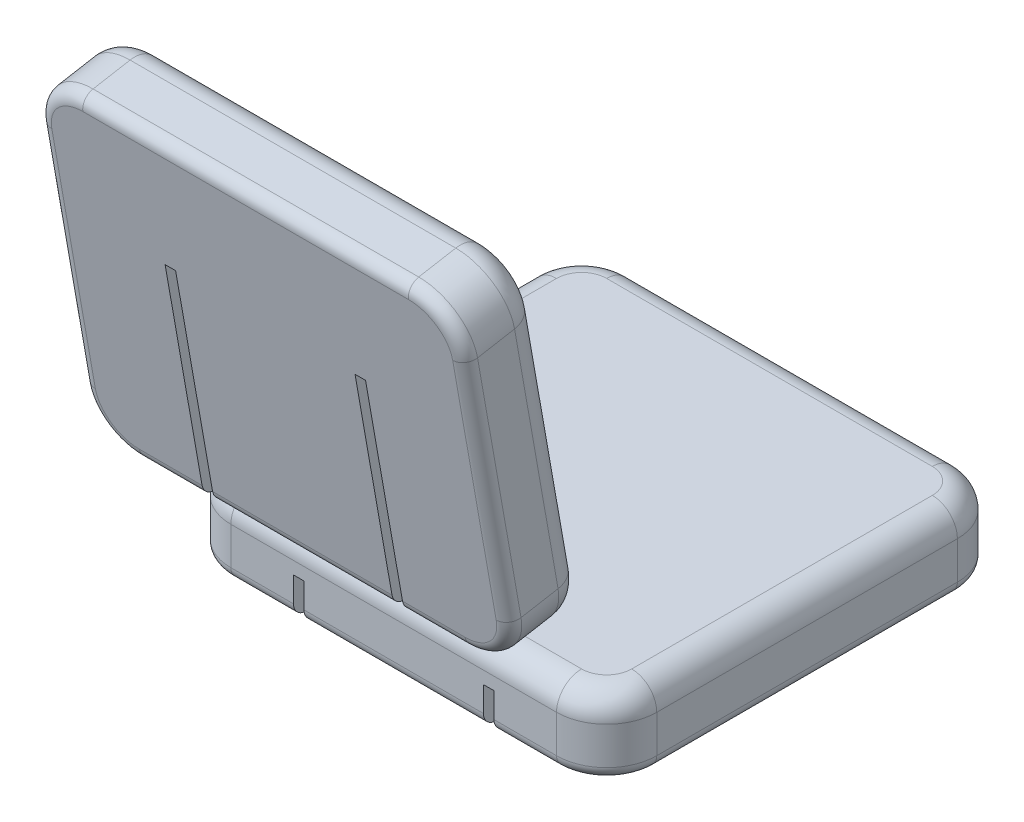
from build123d import *

# Parameters (mm, degrees)
SKETCH1_W           = 160
SKETCH1_H           = 30
BOSS_EXTRUDE1_DEPTH = 85
FILLET5_R           = 5
FILLET6_R           = 5
CUT_EXTRUDE1_START  = -40
CUT_EXTRUDE1_DEPTH  = 4.2
FILLET1_R           = 20
FILLET2_R           = 20
FILLET3_R           = 10
FILLET4_R           = 10
CUT_EXTRUDE3_DEPTH  = 13
FILLET7_R           = 2


with BuildPart() as part:
    # Sketch1 → Boss-Extrude1 (new, symmetric)
    with BuildSketch(Plane(origin=(0, 0, 0), x_dir=(0, 0, -1), z_dir=(1, 0, 0))):
        with Locations((0, -167.4)):
            Rectangle(SKETCH1_W, SKETCH1_H)
        Polygon((-136.5722642, -4.325861041), (-131.250254799, -34.508476203), (-116.478138504, -31.903753538), (-100.849802514, -120.53645131), (-86.077686218, -117.931728645), (-110.388431092, 19.941356777), (-139.932663682, 14.731911447), align=None)
        Polygon((-131.250254799, -34.508476203), (-115.621918809, -123.141173975), (-100.849802514, -120.53645131), (-116.478138504, -31.903753538), align=None)
    extrude(amount=BOSS_EXTRUDE1_DEPTH, both=True)

    # Fillet5
    fillet5_edges = [part.edges().sort_by_distance(p)[0] for p in [
        (0, -123.141173975, 115.621918809),
        (85, -54.204631264, 127.777291245),
        (-85, -54.204631264, 127.777291245),
        (0, 14.731911447, 139.932663682),
    ]]
    fillet(fillet5_edges, radius=FILLET5_R)

    # Fillet6
    fillet6_edges = [part.edges().sort_by_distance(p)[0] for p in [
        (85, -182.4, 0),
        (-85, -182.4, 0),
        (0, -182.4, 80),
        (0, -182.4, -80),
    ]]
    fillet(fillet6_edges, radius=FILLET6_R)

    # Sketch2 → Cut-Extrude1 (cut)
    with BuildSketch(Plane(origin=(0, 0, 0), x_dir=(0, 0, -1), z_dir=(1, 0, 0)).offset(CUT_EXTRUDE1_START)):
        with BuildLine():
            Line((-131.250254799, -34.508476203), (-108.815691981, -161.741204442))
            ThreePointArc((-108.815691981, -161.741204442), (-100.265188398, -176.551111078), (-84.195498156, -182.4))
            Line((-84.195498156, -182.4), (-80, -182.4))
            Line((-80, -182.4), (20, -182.4))
            Line((20, -182.4), (20, -167.4))
            Line((20, -167.4), (-80, -167.4))
            Line((-80, -167.4), (-84.195498156, -167.4))
            ThreePointArc((-84.195498156, -167.4), (-90.623374253, -165.060444431), (-94.043575686, -159.136481777))
            Line((-94.043575686, -159.136481777), (-116.478138504, -31.903753538))
            Line((-116.478138504, -31.903753538), (-131.250254799, -34.508476203))
        make_face()
    cut_extrude1 = extrude(amount=CUT_EXTRUDE1_DEPTH, mode=Mode.SUBTRACT)

    # Mirror1: Cut-Extrude1 across plane
    add(cut_extrude1.mirror(Plane(origin=(0, 0, 0), x_dir=(0, 0, 1), z_dir=(1, 0, 0))), mode=Mode.SUBTRACT)

    # Fillet1
    # the kernel refuses this fillet: 20 mm, written as the material it takes off along each edge
    with BuildSketch(Plane(origin=(65, -182.4, -60), x_dir=(0, 0, -1), z_dir=(-1, 0, 0))) as fillet1_piece_1:
        with BuildLine():
            CenterArc((15, -5), 5, 0, 90)
            Line((20, -5), (20, 0))
            Line((20, 0), (15, 0))
        make_face()
    revolve(axis=Axis((65, -182.4, -60), (0, -1, 0)), revolution_arc=90, mode=Mode.SUBTRACT)
    with BuildSketch(Plane(origin=(-65, -182.4, -60), x_dir=(-1, 0, 0), z_dir=(0, 0, 1))) as fillet1_piece_2:
        with BuildLine():
            CenterArc((15, -5), 5, 0, 90)
            Line((20, -5), (20, 0))
            Line((20, 0), (15, 0))
        make_face()
    revolve(axis=Axis((-65, -182.4, -60), (0, -1, 0)), revolution_arc=90, mode=Mode.SUBTRACT)
    with BuildSketch(Plane(origin=(65, -182.4, 60), x_dir=(1, 0, 0), z_dir=(0, 0, -1))) as fillet1_piece_3:
        with BuildLine():
            CenterArc((15, -5), 5, 0, 90)
            Line((20, -5), (20, 0))
            Line((20, 0), (15, 0))
        make_face()
    revolve(axis=Axis((65, -182.4, 60), (0, -1, 0)), revolution_arc=90, mode=Mode.SUBTRACT)
    with BuildSketch(Plane(origin=(-65, -182.4, 60), x_dir=(0, 0, 1), z_dir=(1, 0, 0))) as fillet1_piece_4:
        with BuildLine():
            CenterArc((15, -5), 5, 0, 90)
            Line((20, -5), (20, 0))
            Line((20, 0), (15, 0))
        make_face()
    revolve(axis=Axis((-65, -182.4, 60), (0, -1, 0)), revolution_arc=90, mode=Mode.SUBTRACT)
    with BuildSketch(Plane(origin=(85, -102.4, -80), x_dir=(0, 0, 1), z_dir=(0, -1, 0)), Plane(origin=(85, -182.4, 80), x_dir=(0, 0, -1), z_dir=(0, 1, 0)), Plane(origin=(-85, -182.4, 80), x_dir=(1, 0, 0), z_dir=(0, 1, 0))) as fillet1_piece_5:
        with BuildLine():
            CenterArc((FILLET1_R, FILLET1_R), FILLET1_R, 180, 90)
            Line((0, FILLET1_R), (0, 0))
            Line((0, 0), (FILLET1_R, 0))
        make_face()
    extrude(amount=80, mode=Mode.SUBTRACT)
    with BuildSketch(Plane(origin=(-85, -102.4, -80), x_dir=(0, 0, 1), z_dir=(0, -1, 0))) as fillet1_piece_6:
        with BuildLine():
            CenterArc((FILLET1_R, -FILLET1_R), FILLET1_R, 90, 90)
            Line((0, -FILLET1_R), (0, 0))
            Line((0, 0), (FILLET1_R, 0))
        make_face()
    extrude(amount=80, mode=Mode.SUBTRACT)

    # Fillet2
    # the kernel refuses this fillet: 20 mm, written as the material it takes off along each edge
    with BuildSketch(Plane(origin=(65, -103.445018914, 119.094882362), x_dir=(0, -0.9848077530122086, -0.17364817766692728), z_dir=(-1, 0, 0))) as fillet2_piece_1:
        with BuildLine():
            CenterArc((15, -5), 5, 0, 90)
            Line((20, -5), (20, 0))
            Line((20, 0), (15, 0))
        make_face()
    revolve(axis=Axis((65, -103.445018914, 119.094882362), (0, -0.17364817766692778, 0.9848077530122086)), revolution_arc=90, mode=Mode.SUBTRACT)
    with BuildSketch(Plane(origin=(-65, -103.445018914, 119.094882362), x_dir=(-1, 0, 0), z_dir=(0, 0.9848077530122086, 0.17364817766692778))) as fillet2_piece_2:
        with BuildLine():
            CenterArc((15, -5), 5, 0, 90)
            Line((20, -5), (20, 0))
            Line((20, 0), (15, 0))
        make_face()
    revolve(axis=Axis((-65, -103.445018914, 119.094882362), (0, -0.17364817766692778, 0.9848077530122086)), revolution_arc=90, mode=Mode.SUBTRACT)
    with BuildSketch(Plane(origin=(65, -4.964243613, 136.459700129), x_dir=(1, 0, 0), z_dir=(0, -0.9848077530122086, -0.17364817766692778))) as fillet2_piece_3:
        with BuildLine():
            CenterArc((15, -5), 5, 0, 90)
            Line((20, -5), (20, 0))
            Line((20, 0), (15, 0))
        make_face()
    revolve(axis=Axis((65, -4.964243613, 136.459700129), (0, -0.17364817766692778, 0.9848077530122086)), revolution_arc=90, mode=Mode.SUBTRACT)
    with BuildSketch(Plane(origin=(-65, -4.964243613, 136.459700129), x_dir=(0, 0.9848077530122086, 0.17364817766692744), z_dir=(1, 0, 0))) as fillet2_piece_4:
        with BuildLine():
            CenterArc((15, -5), 5, 0, 90)
            Line((20, -5), (20, 0))
            Line((20, 0), (15, 0))
        make_face()
    revolve(axis=Axis((-65, -4.964243613, 136.459700129), (0, -0.17364817766692778, 0.9848077530122086)), revolution_arc=90, mode=Mode.SUBTRACT)
    with BuildSketch(Plane(origin=(85, -123.141173975, 115.621918809), x_dir=(0, 0.9848077530122087, 0.17364817766692744), z_dir=(0, 0.17364817766692744, -0.9848077530122086)), Plane(origin=(-85, 28.62376566, 61.148043441), x_dir=(1, 0, 0), z_dir=(0, -0.17364817766692744, 0.9848077530122086))) as fillet2_piece_5:
        with BuildLine():
            CenterArc((FILLET2_R, -FILLET2_R), FILLET2_R, 90, 90)
            Line((0, -FILLET2_R), (0, 0))
            Line((0, 0), (FILLET2_R, 0))
        make_face()
    extrude(amount=80, mode=Mode.SUBTRACT)
    with BuildSketch(Plane(origin=(85, 28.62376566, 61.148043441), x_dir=(-1, 0, 0), z_dir=(0, -0.17364817766692744, 0.9848077530122086)), Plane(origin=(-85, -109.249319761, 36.837298568), x_dir=(1, 0, 0), z_dir=(0, -0.17364817766692744, 0.9848077530122086))) as fillet2_piece_6:
        with BuildLine():
            CenterArc((FILLET2_R, FILLET2_R), FILLET2_R, 180, 90)
            Line((0, FILLET2_R), (0, 0))
            Line((0, 0), (FILLET2_R, 0))
        make_face()
    extrude(amount=80, mode=Mode.SUBTRACT)

    # Fillet3
    fillet3_edges = [part.edges().sort_by_distance(p)[0] for p in [
        (0, 19.941356777, 110.388431092),
        (-79.142135624, 14.172486523, 109.371223618),
        (-79.142135624, -112.162858391, 87.094893692),
        (79.142135624, 14.172486523, 109.371223618),
        (79.142135624, -112.162858391, 87.094893692),
        (0, -117.931728645, 86.077686218),
        (85, -48.995185934, 98.233058655),
        (-85, -48.995185934, 98.233058655),
    ]]
    fillet(fillet3_edges, radius=FILLET3_R)

    # Fillet4
    fillet4_edges = [part.edges().sort_by_distance(p)[0] for p in [
        (79.142135624, -152.4, -74.142135624),
        (0, -152.4, -80),
        (85, -152.4, 0),
        (-85, -152.4, 0),
        (0, -152.4, 80),
        (-79.142135624, -152.4, -74.142135624),
        (-79.142135624, -152.4, 74.142135624),
        (79.142135624, -152.4, 74.142135624),
    ]]
    fillet(fillet4_edges, radius=FILLET4_R)

    # Sketch3 → Cut-Extrude3 (cut)
    with BuildSketch(Plane.XZ.offset(182.4)):
        with BuildLine():
            Line((-25.2, 30), (-25.2, 0))
            ThreePointArc((-25.2, 0), (-23.676955262, -3.676955262), (-20, -5.2))
            Line((-20, -5.2), (20, -5.2))
            ThreePointArc((20, -5.2), (23.676955262, -3.676955262), (25.2, 0))
            Line((25.2, 0), (25.2, 30))
            ThreePointArc((25.2, 30), (23.676955262, 33.676955262), (20, 35.2))
            Line((20, 35.2), (-20, 35.2))
            ThreePointArc((-20, 35.2), (-23.676955262, 33.676955262), (-25.2, 30))
        make_face()
    extrude(amount=-CUT_EXTRUDE3_DEPTH, mode=Mode.SUBTRACT)

    # Fillet7
    fillet7_edges = [part.edges().sort_by_distance(p)[0] for p in [
        (-23.676955262, -182.4, 33.676955262),
        (-25.2, -182.4, 15),
        (-23.676955262, -182.4, -3.676955262),
        (0, -182.4, -5.2),
        (23.676955262, -182.4, -3.676955262),
        (25.2, -182.4, 15),
        (23.676955262, -182.4, 33.676955262),
        (0, -182.4, 35.2),
        (-23.676955262, -169.4, 33.676955262),
        (0, -169.4, 35.2),
        (23.676955262, -169.4, 33.676955262),
        (25.2, -169.4, 15),
        (23.676955262, -169.4, -3.676955262),
        (0, -169.4, -5.2),
        (-23.676955262, -169.4, -3.676955262),
        (-25.2, -169.4, 15),
    ]]
    fillet(fillet7_edges, radius=FILLET7_R)


solid = part.part
